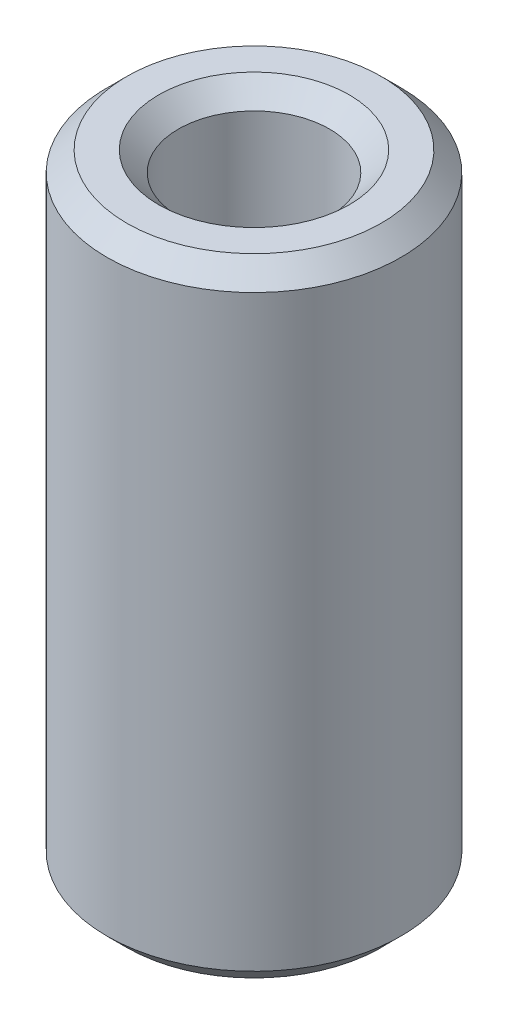
from build123d import *

# Parameters (mm, degrees)
SKETCH1_R           = 10
BOSS_EXTRUDE1_DEPTH = 42.687100032
SKETCH2_R           = 5.141363944
CUT_EXTRUDE1_DEPTH  = 45.968750362
CHAMFER1_SIZE       = 1.34265509


with BuildPart() as part:
    # Sketch1 → Boss-Extrude1 (new body)
    with BuildSketch(Plane(origin=(0, 0, 0), x_dir=(1, 0, 0), z_dir=(0, 1, 0))):
        Circle(SKETCH1_R)
    extrude(amount=BOSS_EXTRUDE1_DEPTH)

    # Sketch2 → Cut-Extrude1 (cut, through all)
    with BuildSketch(Plane(origin=(0, 0, 0), x_dir=(1, 0, 0), z_dir=(0, 1, 0))):
        Circle(SKETCH2_R)
    extrude(amount=CUT_EXTRUDE1_DEPTH, mode=Mode.SUBTRACT)

    # Chamfer1
    chamfer1_edges = [part.edges().sort_by_distance(p)[0] for p in [
        (-5.141363944, 42.687100032, 0),
        (-5.141363944, 0, 0),
        (-10, 0, 0),
        (-10, 42.687100032, 0),
    ]]
    chamfer(chamfer1_edges, length=CHAMFER1_SIZE)


solid = part.part
